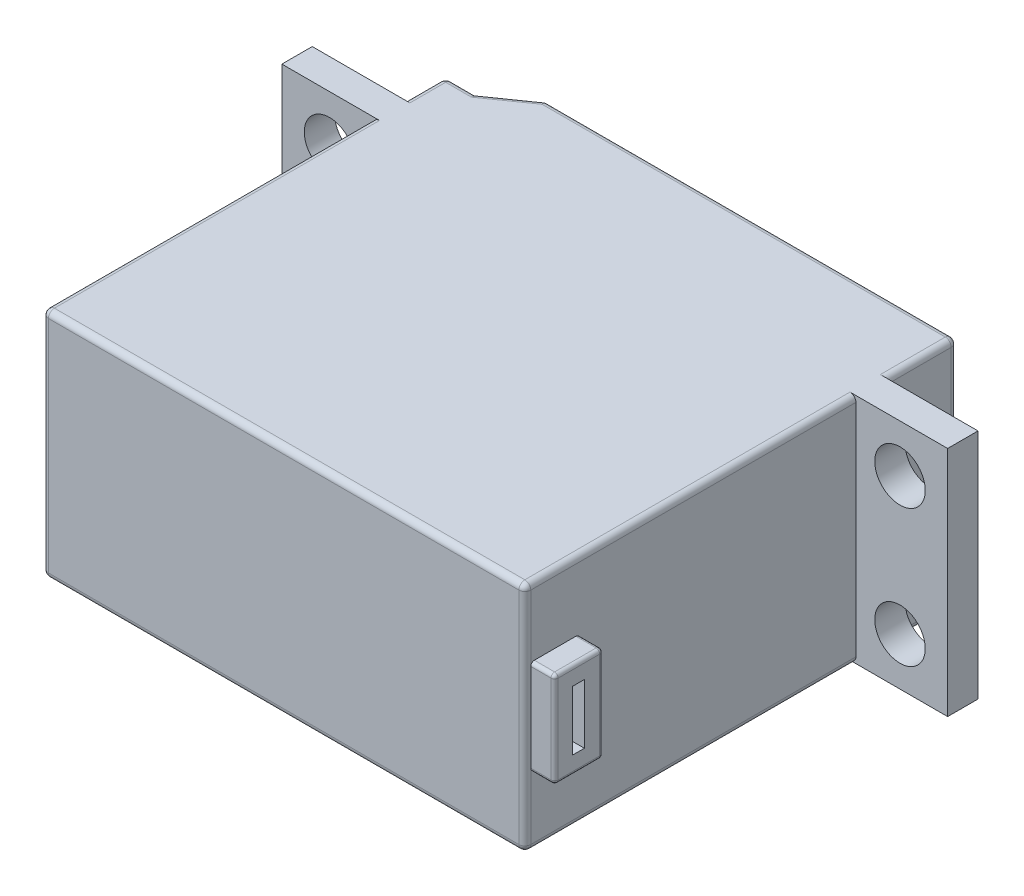
from build123d import *
from OCP.BRepFilletAPI import BRepFilletAPI_MakeChamfer

# Parameters (mm, degrees)
EXTRUSION1_DEPTH        = 19.5
ESQUISSE3_R             = 2.12
ENL_V_MAT_EXTRU_1_DEPTH = 61.204754796
ESQUISSE4_R             = 6.8
EXTRUSION2_DEPTH        = 2
ESQUISSE5_R             = 3
EXTRUSION3_DEPTH        = 3.5
CHANFREIN1_SIZE         = 2
ESQUISSE6_W             = 4
ESQUISSE6_H             = 1.5
EXTRUSION4_DEPTH        = 2
CHANFREIN2_SIZE         = 1
CHANFREIN2_SIZE2        = 1.732050808
ESQUISSE8_W             = 4.087218226
ESQUISSE8_H             = 8
ESQUISSE8_W_2           = 1
ESQUISSE8_H_2           = 5
EXTRUSION5_DEPTH        = 2
CONG_2_R                = 0.5
CONG_3_R                = 0.3


with BuildPart() as part:
    # Esquisse1 → Extrusion1 (new body)
    with BuildSketch(Plane(origin=(0, 0, 0), x_dir=(1, 0, 0), z_dir=(0, 1, 0))):
        Polygon((0, 27.8), (-7.7, 27.8), (-7.7, 30.35), (0, 30.35), (0, 33.85), (2.5, 33.85), (6, 36.3), (40.5, 36.3), (40.5, 30.35), (48.2, 30.35), (48.2, 27.8), (40.5, 27.8), (40.5, 0), (0, 0), align=None)
    extrude(amount=EXTRUSION1_DEPTH)

    # Esquisse3 → Enlèv. mat.-Extru.1 (cut, through all)
    with BuildSketch(Plane(origin=(0, 0, -30.35), x_dir=(-1, 0, 0), z_dir=(0, 0, -1))):
        with Locations((3.7, 4)):
            Circle(ESQUISSE3_R)
        with Locations((3.7, 15.5)):
            Circle(ESQUISSE3_R)
        with Locations((-44.2, 15.5)):
            Circle(ESQUISSE3_R)
        with Locations((-44.2, 4)):
            Circle(ESQUISSE3_R)
    extrude(amount=-ENL_V_MAT_EXTRU_1_DEPTH, mode=Mode.SUBTRACT)

    # Esquisse4 → Extrusion2 (add)
    with BuildSketch(Plane(origin=(0, 0, -36.3), x_dir=(-1, 0, 0), z_dir=(0, 0, -1))):
        with Locations(Location((-30.75, 9.75, 0), (0, 0, 180))):
            Circle(ESQUISSE4_R)
    extrude(amount=EXTRUSION2_DEPTH)

    # Esquisse5 → Extrusion3 (add)
    with BuildSketch(Plane(origin=(0, 0, -38.3), x_dir=(-1, 0, 0), z_dir=(0, 0, -1))):
        with Locations((-30.75, 9.75)):
            Circle(ESQUISSE5_R)
    extrude(amount=EXTRUSION3_DEPTH)

    # Chanfrein1
    chanfrein1_edges = [part.edges().sort_by_distance(p)[0] for p in [
        (23.95, 9.75, -38.3),
    ]]
    chamfer(chanfrein1_edges, length=CHANFREIN1_SIZE - 0.0001)  # a hair under: the kernel refuses the full size

    # Esquisse6 → Extrusion4 (add)
    with BuildSketch(Plane(origin=(0, 0, -30.35), x_dir=(-1, 0, 0), z_dir=(0, 0, -1))):
        with Locations((-42.5, 9.75)):
            Rectangle(ESQUISSE6_W, ESQUISSE6_H)
        with Locations((2, 9.75)):
            Rectangle(ESQUISSE6_W, ESQUISSE6_H)
    extrude(amount=EXTRUSION4_DEPTH)

    # Chanfrein2: one chamfer whose edges measure the first distance from different faces: ONE call of the kernel's chamfer builder (chamfer() names one face for all edges)
    chanfrein2_edges_1 = [part.edges().sort_by_distance(p)[0] for p in [
        (-4, 9.75, -32.35),
    ]]
    chanfrein2_side_1 = [part.faces().sort_by_distance(p)[0] for p in [
        (-4, 9.75, -31.35),
    ]]
    chanfrein2_edges_2 = [part.edges().sort_by_distance(p)[0] for p in [
        (44.5, 9.75, -32.35),
    ]]
    chanfrein2_side_2 = [part.faces().sort_by_distance(p)[0] for p in [
        (44.5, 9.75, -31.35),
    ]]
    chanfrein2 = BRepFilletAPI_MakeChamfer(part.part.solid().wrapped)
    for e in chanfrein2_edges_1:
        chanfrein2.Add(CHANFREIN2_SIZE, CHANFREIN2_SIZE2, e.wrapped, chanfrein2_side_1[0].wrapped)  # the first distance lies on this face
    for e in chanfrein2_edges_2:
        chanfrein2.Add(CHANFREIN2_SIZE, CHANFREIN2_SIZE2, e.wrapped, chanfrein2_side_2[0].wrapped)  # the first distance lies on this face
    add(Compound.cast(chanfrein2.Shape()), mode=Mode.REPLACE)

    # Esquisse8 → Extrusion5 (add)
    with BuildSketch(Plane(origin=(40.5, 0, 0), x_dir=(0, 0, -1), z_dir=(1, 0, 0))):
        with Locations((2.543609113, 9.75)):
            Rectangle(ESQUISSE8_W, ESQUISSE8_H)
        with Locations((2.5, 9.75)):
            Rectangle(ESQUISSE8_W_2, ESQUISSE8_H_2, mode=Mode.SUBTRACT)
    extrude(amount=EXTRUSION5_DEPTH)

    # Congé2
    cong_2_edges = [part.edges().sort_by_distance(p)[0] for p in [
        (40.5, 19.5, -13.9),
        (0, 0, -32.1),
        (1.25, 0, -33.85),
        (4.25, 0, -35.075),
        (23.25, 0, -36.3),
        (40.5, 0, -33.325),
        (40.5, 0, -13.9),
        (20.25, 0, 0),
        (0, 0, -13.9),
        (0, 9.75, -33.85),
        (40.5, 9.75, -36.3),
        (40.5, 19.5, -33.325),
        (40.5, 9.75, 0),
        (0, 9.75, 0),
        (23.25, 19.5, -36.3),
        (4.25, 19.5, -35.075),
        (1.25, 19.5, -33.85),
        (0, 19.5, -32.1),
        (0, 19.5, -13.9),
        (20.25, 19.5, 0),
    ]]
    fillet(cong_2_edges, radius=CONG_2_R - 0.0001)  # a hair under: the kernel refuses the full size

    # Congé3
    cong_3_edges = [part.edges().sort_by_distance(p)[0] for p in [
        (42.5, 9.75, -0.5),
        (42.5, 5.75, -2.543609113),
        (42.5, 9.75, -4.587218226),
        (42.5, 13.75, -2.543609113),
        (41.5, 13.75, -0.5),
        (41.5, 5.75, -0.5),
        (41.5, 5.75, -4.587218226),
        (41.5, 13.75, -4.587218226),
    ]]
    fillet(cong_3_edges, radius=CONG_3_R)


solid = part.part
